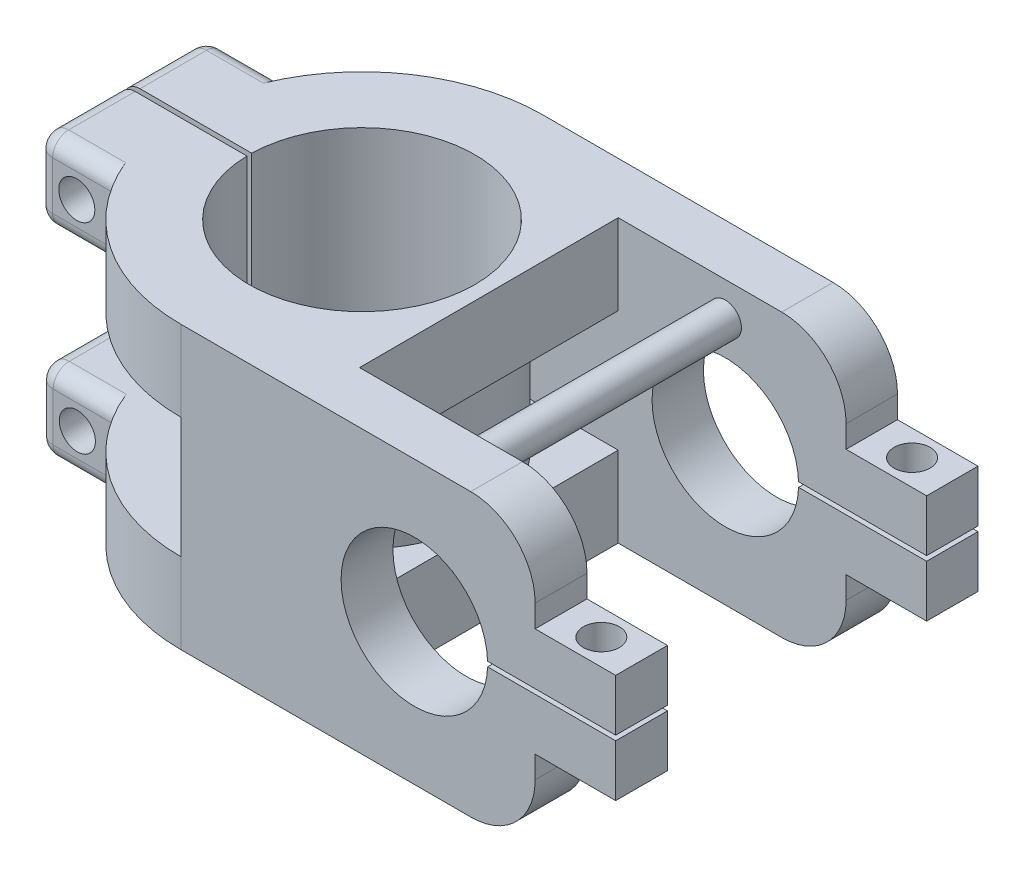
from build123d import *

# Parameters (mm, degrees)
SKETCH2_R                 = 28.575
SKETCH2_R_2               = 17.78
BOSS_EXTRUDE3_DEPTH       = 12.7
SKETCH3_W                 = 10.854473524
SKETCH3_H                 = 26.443507434
CUT_EXTRUDE1_DEPTH        = 12.7
CUT_EXTRUDE2_DEPTH        = 12.7
SKETCH5_W                 = 12.840753717
SKETCH5_H                 = 12.7
BOSS_EXTRUDE4_DEPTH       = 12.7
SKETCH6_W                 = 12.840753717
SKETCH6_H                 = 12.7
BOSS_EXTRUDE5_DEPTH       = 12.7
SKETCH7_R                 = 2.8448
CUT_EXTRUDE3_DEPTH        = 33.02
FILLET1_R                 = 2.54
FILLET2_R                 = 2.54
FILLET3_R                 = 2.54
FILLET4_R                 = 2.54
FILLET5_R                 = 2.54
FILLET6_R                 = 2.54
SKETCH8_R                 = 18.738819316
SKETCH8_R_2               = 17.78
BOSS_EXTRUDE6_DEPTH       = 19.05
SKETCH9_R                 = 28.575
BOSS_EXTRUDE7_DEPTH       = 12.7
SKETCH12_W                = 11.37566774
SKETCH12_H                = 26.806734356
CUT_EXTRUDE4_DEPTH        = 12.7
SKETCH13_W                = 26.806734356
SKETCH13_H                = 12.7
BOSS_EXTRUDE8_DEPTH       = 12.7
CUT_EXTRUDE5_START        = -12.7
SKETCH14_R                = 17.78
CUT_EXTRUDE5_DEPTH        = 12.7
CUT_EXTRUDE6_START        = -12.7
CUT_EXTRUDE6_DEPTH        = 12.7
SKETCH16_W                = 20.93971863
SKETCH16_H                = 0.381
CUT_EXTRUDE7_DEPTH        = 12.7
FILLET7_R                 = 2.54
FILLET8_R                 = 2.54
FILLET9_R                 = 2.54
FILLET10_R                = 2.54
FILLET11_R                = 2.54
FILLET12_R                = 2.54
SKETCH17_R                = 2.8448
CUT_EXTRUDE8_DEPTH        = 29.464
SKETCH19_W                = 1.827097527
SKETCH19_H                = 0.762
CUT_EXTRUDE13_DEPTH       = 29.464
BOSS_EXTRUDE12_DEPTH      = 31.75
BOSS_EXTRUDE12_DEPTH_BACK = 12.7
SKETCH22_W                = 55.88
SKETCH22_H                = 8.17709812
BOSS_EXTRUDE13_DEPTH      = 31.75
BOSS_EXTRUDE13_DEPTH_BACK = 12.7
SKETCH23_W                = 55.88
SKETCH23_H                = 8.104128776
SKETCH24_R                = 11.557
CUT_EXTRUDE14_DEPTH       = 67.31
FILLET13_R                = 10.16
FILLET14_R                = 10.16
FILLET15_R                = 10.16
FILLET16_R                = 10.16
CUT_EXTRUDE15_DEPTH       = 67.31
SKETCH26_R                = 2.54
BOSS_EXTRUDE14_DEPTH      = 43.434
SKETCH27_W                = 10.889060874
SKETCH27_H                = 0.381
CUT_EXTRUDE16_DEPTH       = 64.516
SKETCH28_W                = 8.900082699
SKETCH28_H                = 0.381
CUT_EXTRUDE17_DEPTH       = 64.516
SKETCH29_W                = 8.17709812
SKETCH29_H                = 8.1770982
BOSS_EXTRUDE15_DEPTH      = 12.7
SKETCH30_W                = 8.17709812
SKETCH30_H                = 8.1770982
BOSS_EXTRUDE16_DEPTH      = 12.7
SKETCH31_R                = 2.8448
CUT_EXTRUDE18_DEPTH       = 22.098
SKETCH34_W                = 8.104128776
SKETCH34_H                = 8.1770982
BOSS_EXTRUDE17_DEPTH      = 12.7
SKETCH35_W                = 8.104128776
SKETCH35_H                = 8.1770982
BOSS_EXTRUDE18_DEPTH      = 12.7
SKETCH36_R                = 2.8448
CUT_EXTRUDE19_DEPTH       = 27.686


with BuildPart() as part:
    # Sketch2 → Boss-Extrude3 (new body)
    with BuildSketch(Plane(origin=(0, 0, 0), x_dir=(1, 0, 0), z_dir=(0, 1, 0))):
        Circle(SKETCH2_R)
        Circle(SKETCH2_R_2, mode=Mode.SUBTRACT)
    extrude(amount=BOSS_EXTRUDE3_DEPTH)

    # Sketch3 → Cut-Extrude1 (cut)
    with BuildSketch(Plane(origin=(0, 12.7, 0), x_dir=(1, 0, 0), z_dir=(0, 1, 0))):
        with Locations((-30.759347879, 0)):
            Rectangle(SKETCH3_W, SKETCH3_H)
    extrude(amount=-CUT_EXTRUDE1_DEPTH, mode=Mode.SUBTRACT)

    # Sketch4 → Cut-Extrude2 (cut)
    with BuildSketch(Plane(origin=(0, 12.7, 0), x_dir=(1, 0, 0), z_dir=(0, 1, 0))):
        Polygon((-16.376768267, 0), (-16.376768267, 0.381), (-26.003615217, 0.381), (-26.003615217, -0.381), (-16.376768267, -0.381), align=None)
    extrude(amount=-CUT_EXTRUDE2_DEPTH, mode=Mode.SUBTRACT)

    # Sketch5 → Boss-Extrude4 (add)
    with BuildSketch(Plane.ZY.offset(25.332111117)):
        with Locations((6.801376859, 6.35)):
            Rectangle(SKETCH5_W, SKETCH5_H)
    extrude(amount=BOSS_EXTRUDE4_DEPTH)

    # Sketch6 → Boss-Extrude5 (add)
    with BuildSketch(Plane.ZY.offset(25.332111117)):
        with Locations((-6.801376859, 6.35)):
            Rectangle(SKETCH6_W, SKETCH6_H)
    extrude(amount=BOSS_EXTRUDE5_DEPTH)

    # Sketch7 → Cut-Extrude3 (cut)
    with BuildSketch(Plane.XY.offset(13.221753717)):
        with Locations((-31.682111117, 6.35)):
            Circle(SKETCH7_R)
    extrude(amount=-CUT_EXTRUDE3_DEPTH, mode=Mode.SUBTRACT)

    # Fillet1
    fillet1_edges = [part.edges().sort_by_distance(p)[0] for p in [
        (-38.032111117, 6.35, 13.221753717),
    ]]
    fillet(fillet1_edges, radius=FILLET1_R)

    # Fillet2
    fillet2_edges = [part.edges().sort_by_distance(p)[0] for p in [
        (-38.032111117, 6.35, -13.221753717),
    ]]
    fillet(fillet2_edges, radius=FILLET2_R)

    # Fillet3
    fillet3_edges = [part.edges().sort_by_distance(p)[0] for p in [
        (-30.412111117, 12.7, -13.221753717),
        (-37.288162341, 12.7, -12.477804942),
        (-38.032111117, 12.7, -5.531376859),
    ]]
    fillet(fillet3_edges, radius=FILLET3_R)

    # Fillet4
    fillet4_edges = [part.edges().sort_by_distance(p)[0] for p in [
        (-30.412111117, 12.7, 13.221753717),
        (-37.288162341, 12.7, 12.477804942),
        (-38.032111117, 12.7, 5.531376859),
    ]]
    fillet(fillet4_edges, radius=FILLET4_R)

    # Fillet5
    fillet5_edges = [part.edges().sort_by_distance(p)[0] for p in [
        (-30.412111117, 0, -13.221753717),
        (-37.288162341, 0, -12.477804942),
        (-38.032111117, 0, -5.531376859),
    ]]
    fillet(fillet5_edges, radius=FILLET5_R)

    # Fillet6
    fillet6_edges = [part.edges().sort_by_distance(p)[0] for p in [
        (-30.412111117, 0, 13.221753717),
        (-37.288162341, 0, 12.477804942),
        (-38.032111117, 0, 5.531376859),
    ]]
    fillet(fillet6_edges, radius=FILLET6_R)

    # Sketch8 → Boss-Extrude6 (add)
    with BuildSketch(Plane(origin=(0, 12.7, 0), x_dir=(1, 0, 0), z_dir=(0, 1, 0))):
        Circle(SKETCH8_R)
        Circle(SKETCH8_R_2, mode=Mode.SUBTRACT)
    extrude(amount=BOSS_EXTRUDE6_DEPTH)

    # Sketch9 → Boss-Extrude7 (add)
    with BuildSketch(Plane(origin=(0, 31.75, 0), x_dir=(1, 0, 0), z_dir=(0, 1, 0))):
        Circle(SKETCH9_R)
    extrude(amount=BOSS_EXTRUDE7_DEPTH)

    # Sketch12 → Cut-Extrude4 (cut)
    with BuildSketch(Plane(origin=(0, 44.45, 0), x_dir=(1, 0, 0), z_dir=(0, 1, 0))):
        with Locations((-30.924322796, 0)):
            Rectangle(SKETCH12_W, SKETCH12_H)
    extrude(amount=-CUT_EXTRUDE4_DEPTH, mode=Mode.SUBTRACT)

    # Sketch13 → Boss-Extrude8 (add)
    with BuildSketch(Plane.ZY.offset(25.236488926)):
        with Locations((0, 38.1)):
            Rectangle(SKETCH13_W, SKETCH13_H)
    extrude(amount=BOSS_EXTRUDE8_DEPTH)

    # Sketch14 → Cut-Extrude5 (cut)
    with BuildSketch(Plane(origin=(0, 44.45, 0), x_dir=(1, 0, 0), z_dir=(0, 1, 0)).offset(CUT_EXTRUDE5_START)):
        Circle(SKETCH14_R)
    extrude(amount=CUT_EXTRUDE5_DEPTH, mode=Mode.SUBTRACT)

    # Sketch15 → Cut-Extrude6 (cut)
    with BuildSketch(Plane(origin=(0, 44.45, 0), x_dir=(1, 0, 0), z_dir=(0, 1, 0)).offset(CUT_EXTRUDE6_START)):
        with BuildLine():
            Line((-37.936488926, 0.381), (-37.936488926, 0))
            Line((-37.936488926, 0), (-17.78, 0))
            ThreePointArc((-17.78, 0), (-17.778979318, 0.190510937), (-17.775917388, 0.381))
            Line((-17.775917388, 0.381), (-37.936488926, 0.381))
        make_face()
    extrude(amount=CUT_EXTRUDE6_DEPTH, mode=Mode.SUBTRACT)

    # Sketch16 → Cut-Extrude7 (cut)
    with BuildSketch(Plane(origin=(0, 44.45, 0), x_dir=(1, 0, 0), z_dir=(0, 1, 0))):
        with Locations((-27.466629611, -0.1905)):
            Rectangle(SKETCH16_W, SKETCH16_H)
    extrude(amount=-CUT_EXTRUDE7_DEPTH, mode=Mode.SUBTRACT)

    # Fillet7
    fillet7_edges = [part.edges().sort_by_distance(p)[0] for p in [
        (-37.936488926, 44.45, -6.892183589),
    ]]
    fillet(fillet7_edges, radius=FILLET7_R)

    # Fillet8
    fillet8_edges = [part.edges().sort_by_distance(p)[0] for p in [
        (-37.936488926, 44.45, 6.892183589),
    ]]
    fillet(fillet8_edges, radius=FILLET8_R)

    # Fillet9
    fillet9_edges = [part.edges().sort_by_distance(p)[0] for p in [
        (-37.936488926, 31.75, -6.892183589),
    ]]
    fillet(fillet9_edges, radius=FILLET9_R)

    # Fillet10
    fillet10_edges = [part.edges().sort_by_distance(p)[0] for p in [
        (-37.936488926, 31.75, 6.892183589),
    ]]
    fillet(fillet10_edges, radius=FILLET10_R)

    # Fillet11
    fillet11_edges = [part.edges().sort_by_distance(p)[0] for p in [
        (-30.316488926, 31.75, 13.403367178),
        (-37.19254015, 32.493948776, 13.403367178),
        (-30.316488926, 44.45, 13.403367178),
        (-37.19254015, 43.706051224, 13.403367178),
        (-37.936488926, 38.1, 13.403367178),
    ]]
    fillet(fillet11_edges, radius=FILLET11_R)

    # Fillet12
    fillet12_edges = [part.edges().sort_by_distance(p)[0] for p in [
        (-30.316488926, 44.45, -13.403367178),
        (-37.19254015, 43.706051224, -13.403367178),
        (-30.316488926, 31.75, -13.403367178),
        (-37.19254015, 32.493948776, -13.403367178),
        (-37.936488926, 38.1, -13.403367178),
    ]]
    fillet(fillet12_edges, radius=FILLET12_R)

    # Sketch17 → Cut-Extrude8 (cut)
    with BuildSketch(Plane.XY.offset(13.403367178)):
        with Locations((-31.586488926, 38.1)):
            Circle(SKETCH17_R)
    extrude(amount=-CUT_EXTRUDE8_DEPTH, mode=Mode.SUBTRACT)

    # Sketch19 → Cut-Extrude13 (cut)
    with BuildSketch(Plane(origin=(0, 31.75, 0), x_dir=(1, 0, 0), z_dir=(0, 1, 0))):
        with Locations((-17.821396883, 0)):
            Rectangle(SKETCH19_W, SKETCH19_H)
    extrude(amount=-CUT_EXTRUDE13_DEPTH, mode=Mode.SUBTRACT)


with BuildPart() as cut_extrude13_kept_piece:
    # of the separate pieces the step leaves, the one the design keeps (cut_extrude13_pieces_kept)
    add(part.part.solids().sort_by_distance((-35.396488926, 31.75, -10.863367178))[0])

    # Sketch22 → Boss-Extrude12 (add, two sides: drawn at the far end of the back side and taken through both)
    with BuildSketch(Plane(origin=(0, 12.7, 0), x_dir=(1, 0, 0), z_dir=(0, 1, 0)).offset(-BOSS_EXTRUDE12_DEPTH_BACK)):
        with Locations((27.94, -24.48645094)):
            Rectangle(SKETCH22_W, SKETCH22_H)
    extrude(amount=BOSS_EXTRUDE12_DEPTH + BOSS_EXTRUDE12_DEPTH_BACK)

    # Sketch23 → Boss-Extrude13 (add, two sides: drawn at the far end of the back side and taken through both)
    with BuildSketch(Plane(origin=(0, 12.7, 0), x_dir=(1, 0, 0), z_dir=(0, 1, 0)).offset(-BOSS_EXTRUDE13_DEPTH_BACK)):
        with Locations((27.94, 24.522935612)):
            Rectangle(SKETCH23_W, SKETCH23_H)
    extrude(amount=BOSS_EXTRUDE13_DEPTH + BOSS_EXTRUDE13_DEPTH_BACK)

    # Sketch24 → Cut-Extrude14 (cut)
    with BuildSketch(Plane(origin=(0, 0, -28.575), x_dir=(-1, 0, 0), z_dir=(0, 0, -1))):
        with Locations((-36.83, 22.225)):
            Circle(SKETCH24_R)
    extrude(amount=-CUT_EXTRUDE14_DEPTH, mode=Mode.SUBTRACT)

    # Fillet13
    fillet13_edges = [cut_extrude13_kept_piece.edges().sort_by_distance(p)[0] for p in [
        (55.88, 44.45, 24.48645094),
    ]]
    fillet(fillet13_edges, radius=FILLET13_R)

    # Fillet14
    fillet14_edges = [cut_extrude13_kept_piece.edges().sort_by_distance(p)[0] for p in [
        (55.88, 0, 24.48645094),
    ]]
    fillet(fillet14_edges, radius=FILLET14_R)

    # Fillet15
    fillet15_edges = [cut_extrude13_kept_piece.edges().sort_by_distance(p)[0] for p in [
        (55.88, 44.45, -24.522935612),
    ]]
    fillet(fillet15_edges, radius=FILLET15_R)

    # Fillet16
    fillet16_edges = [cut_extrude13_kept_piece.edges().sort_by_distance(p)[0] for p in [
        (55.88, 0, -24.522935612),
    ]]
    fillet(fillet16_edges, radius=FILLET16_R)

    # Sketch25 → Cut-Extrude15 (cut)
    with BuildSketch(Plane(origin=(0, 44.45, 0), x_dir=(1, 0, 0), z_dir=(0, 1, 0))):
        Polygon((28.57495233, 0.052195041), (28.57495233, 20.470871224), (19.936751399, 20.470871224), (20.011402347, -20.39790188), (28.575, -20.39790188), align=None)
    extrude(amount=-CUT_EXTRUDE15_DEPTH, mode=Mode.SUBTRACT)


with BuildPart() as cut_extrude15_kept_piece:
    # of the separate pieces the step leaves, the one the design keeps (cut_extrude15_pieces_kept)
    add(cut_extrude13_kept_piece.part.solids().sort_by_distance((55.88, 10.16, -20.470871224))[0])

    # Sketch26 → Boss-Extrude14 (add)
    with BuildSketch(Plane.XY.offset(-20.470871224)):
        with Locations((36.83, 39.116)):
            Circle(SKETCH26_R)
    extrude(amount=BOSS_EXTRUDE14_DEPTH)

    # Sketch27 → Cut-Extrude16 (cut)
    with BuildSketch(Plane.XY.offset(28.575)):
        with Locations((52.414940452, 22.4155)):
            Rectangle(SKETCH27_W, SKETCH27_H)
    extrude(amount=-CUT_EXTRUDE16_DEPTH, mode=Mode.SUBTRACT)

    # Sketch28 → Cut-Extrude17 (cut)
    with BuildSketch(Plane.XY.offset(28.575)):
        with Locations((52.021010234, 22.0345)):
            Rectangle(SKETCH28_W, SKETCH28_H)
    extrude(amount=-CUT_EXTRUDE17_DEPTH, mode=Mode.SUBTRACT)

    # Sketch29 → Boss-Extrude15 (add)
    with BuildSketch(Plane(origin=(55.88, 0, 0), x_dir=(0, 0, -1), z_dir=(1, 0, 0))):
        with Locations((-24.48645094, 26.6945491)):
            Rectangle(SKETCH29_W, SKETCH29_H)
    extrude(amount=BOSS_EXTRUDE15_DEPTH)

    # Sketch30 → Boss-Extrude16 (add)
    with BuildSketch(Plane(origin=(55.88, 0, 0), x_dir=(0, 0, -1), z_dir=(1, 0, 0))):
        with Locations((-24.48645094, 17.7554509)):
            Rectangle(SKETCH30_W, SKETCH30_H)
    extrude(amount=BOSS_EXTRUDE16_DEPTH)

    # Sketch31 → Cut-Extrude18 (cut)
    with BuildSketch(Plane(origin=(0, 30.7830982, 0), x_dir=(1, 0, 0), z_dir=(0, 1, 0))):
        with Locations((62.23, -24.48645094)):
            Circle(SKETCH31_R)
    extrude(amount=-CUT_EXTRUDE18_DEPTH, mode=Mode.SUBTRACT)

    # Sketch34 → Boss-Extrude17 (add)
    with BuildSketch(Plane(origin=(55.88, 0, 0), x_dir=(0, 0, -1), z_dir=(1, 0, 0))):
        with Locations((24.522935612, 26.6945491)):
            Rectangle(SKETCH34_W, SKETCH34_H)
    extrude(amount=BOSS_EXTRUDE17_DEPTH)

    # Sketch35 → Boss-Extrude18 (add)
    with BuildSketch(Plane(origin=(55.88, 0, 0), x_dir=(0, 0, -1), z_dir=(1, 0, 0))):
        with Locations((24.522935612, 17.7554509)):
            Rectangle(SKETCH35_W, SKETCH35_H)
    extrude(amount=BOSS_EXTRUDE18_DEPTH)

    # Sketch36 → Cut-Extrude19 (cut)
    with BuildSketch(Plane(origin=(0, 30.7830982, 0), x_dir=(1, 0, 0), z_dir=(0, 1, 0))):
        with Locations((62.23, 24.522935612)):
            Circle(SKETCH36_R)
    extrude(amount=-CUT_EXTRUDE19_DEPTH, mode=Mode.SUBTRACT)


solid = cut_extrude15_kept_piece.part
